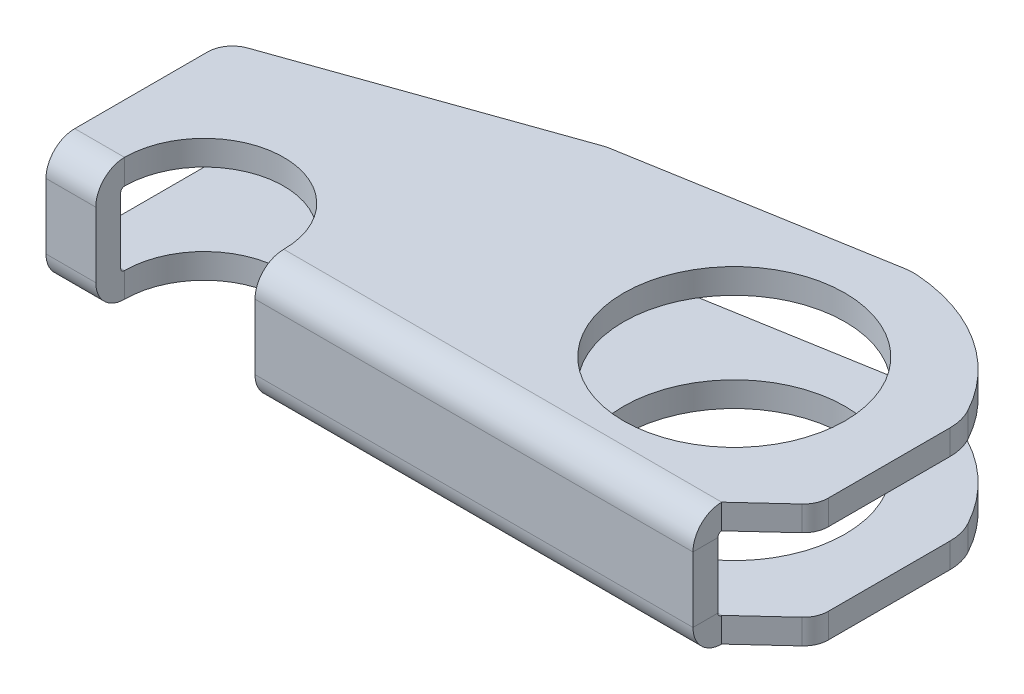
from build123d import *

# Parameters (mm, degrees)
BASE_FLANGE1_DEPTH      = 70
CUT_EXTRUDE2_DEPTH      = 99.666559685
CUT_EXTRUDE2_DEPTH_BACK = 99.666559685
SKETCH6_R               = 22.25
CUT_EXTRUDE3_START      = -24.7
CUT_EXTRUDE3_DEPTH      = 24.7
FILLET1_R               = 10
FILLET2_R               = 5


# Read off the part's stored shape, not the designer's step: Cut-Extrude3
# Sheet-metal steps are written as plain solids
with BuildPart() as part:
    # Sketch1 → Base-Flange1 (new, symmetric)
    with BuildSketch(Plane(origin=(0, 0, 0), x_dir=(0, 0, -1), z_dir=(1, 0, 0))):
        with BuildLine():
            Line((0, 0), (-59.22, 0))
            ThreePointArc((-59.22, 0), (-63.307077195, 1.692922805), (-65, 5.78))
            Line((-65, 5.78), (-65, 18.92))
            ThreePointArc((-65, 18.92), (-63.307077195, 23.007077195), (-59.22, 24.7))
            Line((-59.22, 24.7), (0, 24.7))
            Line((0, 24.7), (0, 19.7))
            Line((0, 19.7), (-59.22, 19.7))
            ThreePointArc((-59.22, 19.7), (-59.771543289, 19.471543289), (-60, 18.92))
            Line((-60, 18.92), (-60, 5.78))
            ThreePointArc((-60, 5.78), (-59.771543289, 5.228456711), (-59.22, 5))
            Line((-59.22, 5), (0, 5))
            Line((0, 5), (0, 0))
        make_face()
    extrude(amount=BASE_FLANGE1_DEPTH, both=True)

    # Sketch6 → Cut-Extrude2 (cut, two sides: drawn at the far end of the back side and taken through both)
    with BuildSketch(Plane(origin=(0, 0, 0), x_dir=(1, 0, 0), z_dir=(0, 1, 0)).offset(-CUT_EXTRUDE2_DEPTH_BACK)):
        with Locations(Location((36, -32.7, 0), (0, 0, 270))):
            Circle(SKETCH6_R)
    extrude(amount=CUT_EXTRUDE2_DEPTH + CUT_EXTRUDE2_DEPTH_BACK, mode=Mode.SUBTRACT)

    # Cut-Extrude3 outline → Cut-Extrude3 (cut)
    with BuildSketch(Plane(origin=(0, 24.7, 0), x_dir=(1, 0, 0), z_dir=(0, 1, 0)).offset(CUT_EXTRUDE3_START)):
        with BuildLine():
            add(Edge.make_bspline(
                [(-28, -59.22), (-28.001483373, -59.059147185), (-28.006444043, -58.521225961), (-28.068654058, -57.607370733), (-28.221663959, -56.485748427), (-28.454487396, -55.377760999), (-28.76476049, -54.288987367), (-29.151253932, -53.224858787), (-29.611949694, -52.190697164), (-30.144568106, -51.191670906), (-30.746440721, -50.232773794), (-31.414560774, -49.318798758), (-32.145588265, -48.454314261), (-32.935869316, -47.643641371), (-33.781453727, -46.890832185), (-34.678114904, -46.199649575), (-35.621370941, -45.573548372), (-36.606507032, -45.015658105), (-37.628599035, -44.528767354), (-38.682538088, -44.11530981), (-39.763056142, -43.777352116), (-40.864752295, -43.516583532), (-41.982119787, -43.334307495), (-43.109573528, -43.231435098), (-44.24147801, -43.208480544), (-45.372175479, -43.265558569), (-46.496014214, -43.402383872), (-47.607376779, -43.618272541), (-48.700708096, -43.91214547), (-49.770543218, -44.282533752), (-50.81153464, -44.727586026), (-51.818479031, -45.245077726), (-52.786343244, -45.832422201), (-53.71028947, -46.486683647), (-54.585699418, -47.204591779), (-55.408197421, -47.982558178), (-56.17367222, -48.816694228), (-56.878297832, -49.702830551), (-57.518551508, -50.636537851), (-58.091235675, -51.613149051), (-58.593477749, -52.627782619), (-59.022804836, -53.675366973), (-59.376930909, -54.75066583), (-59.654608607, -55.848304374), (-59.852499172, -56.962796127), (-59.976893957, -58.088570374), (-59.992297986, -58.842856791), (-60, -59.22)],
                knots=[0, 0, 0, 0, 0.009602085, 0.032111129, 0.054620172, 0.077129216, 0.099638259, 0.122147303, 0.144656346, 0.16716539, 0.189674433, 0.212183477, 0.23469252, 0.257201564, 0.279710607, 0.302219651, 0.324728695, 0.347237738, 0.369746782, 0.392255825, 0.414764869, 0.437273912, 0.459782956, 0.482291999, 0.504801043, 0.527310086, 0.54981913, 0.572328173, 0.594837217, 0.61734626, 0.639855304, 0.662364347, 0.684873391, 0.707382434, 0.729891478, 0.752400521, 0.774909565, 0.797418608, 0.819927652, 0.842436695, 0.864945739, 0.887454782, 0.909963826, 0.932472869, 0.954981913, 0.977490956, 1, 1, 1, 1], degree=3))
            Line((-60, -59.22), (-60, -65))
            Line((-60, -65), (-28, -65))
            Line((-28, -65), (-28, -59.22))
        make_face()
        Polygon((-13.431457505, -9), (38.798801924, 0), (-70, 0), (-70, -29), align=None)
        with BuildLine():
            ThreePointArc((38.798801924, 0), (57.406545367, -6.032071037), (70, -21))
            Line((70, -21), (70, 0))
            Line((70, 0), (38.798801924, 0))
        make_face()
        Polygon((70, -65), (70, -50), (60, -59.22), (60, -65), align=None)
    extrude(amount=CUT_EXTRUDE3_DEPTH, mode=Mode.SUBTRACT)

    # Fillet1
    fillet1_edges = [part.edges().sort_by_distance(p)[0] for p in [
        (38.798801924, 22.2, 0),
        (-13.431457505, 22.2, 9),
        (70, 2.5, 21),
        (38.798801924, 2.5, 0),
        (-13.431457505, 2.5, 9),
        (70, 22.2, 21),
    ]]
    fillet(fillet1_edges, radius=FILLET1_R)

    # Fillet2
    fillet2_edges = [part.edges().sort_by_distance(p)[0] for p in [
        (-70, 22.2, 29),
        (70, 2.5, 50),
        (70, 22.2, 50),
        (-70, 2.5, 29),
    ]]
    fillet(fillet2_edges, radius=FILLET2_R)


solid = part.part
